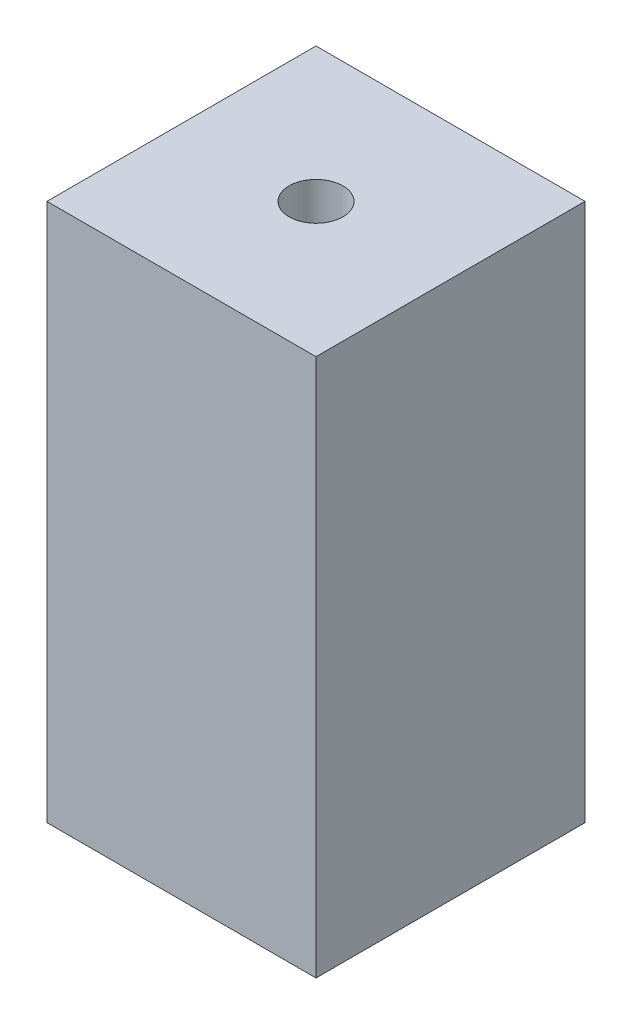
from build123d import *

# Parameters (mm, degrees)
SKETCH1_W           = 15
SKETCH1_H           = 15
SKETCH1_R           = 1.5
BOSS_EXTRUDE1_DEPTH = 30


with BuildPart() as part:
    # Sketch1 → Boss-Extrude1 (new body)
    with BuildSketch(Plane(origin=(0, 0, 0), x_dir=(1, 0, 0), z_dir=(0, 1, 0))):
        Rectangle(SKETCH1_W, SKETCH1_H)
        Circle(SKETCH1_R, mode=Mode.SUBTRACT)
    extrude(amount=BOSS_EXTRUDE1_DEPTH)


solid = part.part
